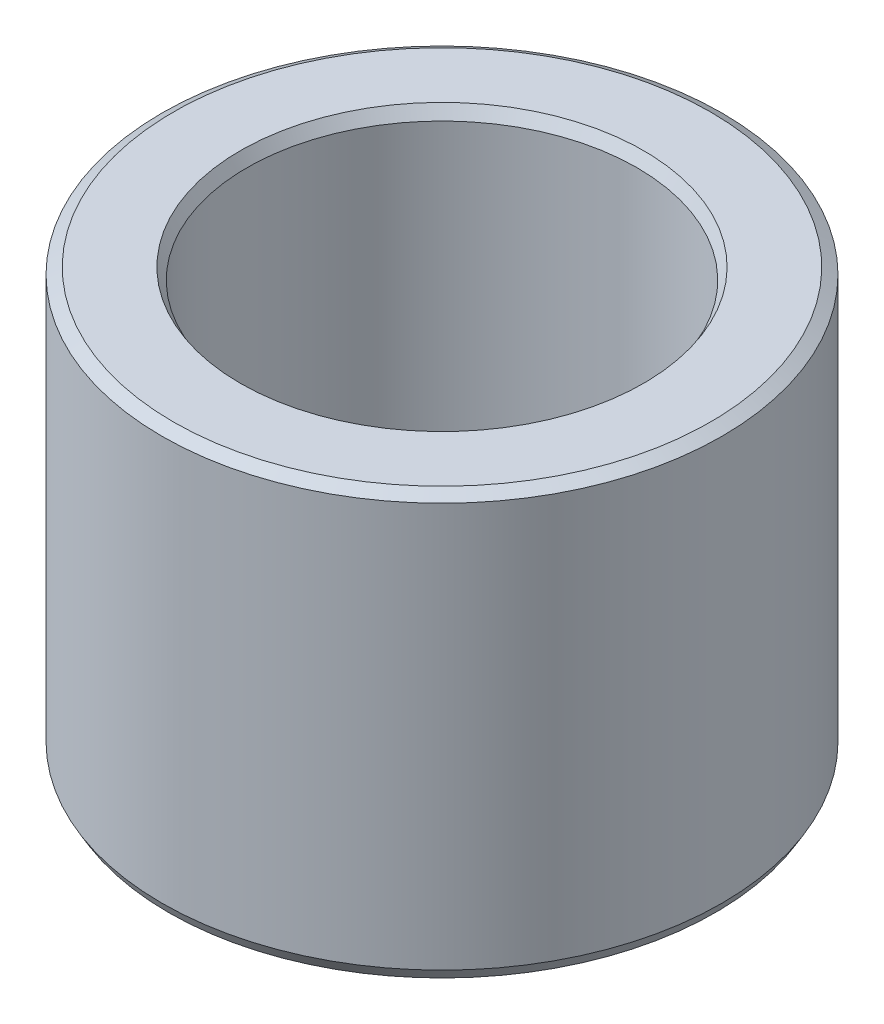
from build123d import *
from OCP.BRepFilletAPI import BRepFilletAPI_MakeChamfer

# Parameters (mm, degrees)
SKETCH1_R           = 57.5
BOSS_EXTRUDE1_DEPTH = 86.751483869
SKETCH2_R           = 40.041894968
CUT_EXTRUDE1_DEPTH  = 119.904667501
CHAMFER1_SIZE       = 1.359545545
CHAMFER1_SIZE2      = 2.354801958


with BuildPart() as part:
    # Sketch1 → Boss-Extrude1 (new body)
    with BuildSketch(Plane(origin=(0, 0, 0), x_dir=(1, 0, 0), z_dir=(0, 1, 0))):
        Circle(SKETCH1_R)
    extrude(amount=BOSS_EXTRUDE1_DEPTH)

    # Sketch2 → Cut-Extrude1 (cut, through all)
    with BuildSketch(Plane(origin=(0, 0, 0), x_dir=(1, 0, 0), z_dir=(0, 1, 0))):
        Circle(SKETCH2_R)
    extrude(amount=CUT_EXTRUDE1_DEPTH, mode=Mode.SUBTRACT)

    # Chamfer1: one chamfer whose edges measure the first distance from different faces: ONE call of the kernel's chamfer builder (chamfer() names one face for all edges)
    chamfer1_edges_1 = [part.edges().sort_by_distance(p)[0] for p in [
        (-40.041894968, 86.751483869, 0),
    ]]
    chamfer1_side_1 = [part.faces().sort_by_distance(p)[0] for p in [
        (-55.873654403, 86.751483869, 0),
    ]]
    chamfer1_edges_2 = [part.edges().sort_by_distance(p)[0] for p in [
        (-40.041894968, 0, 0),
    ]]
    chamfer1_side_2 = [part.faces().sort_by_distance(p)[0] for p in [
        (-40.041894968, 43.375741935, 0),
    ]]
    chamfer1_edges_3 = [part.edges().sort_by_distance(p)[0] for p in [
        (-57.5, 0, 0),
    ]]
    chamfer1_side_3 = [part.faces().sort_by_distance(p)[0] for p in [
        (-55.873654403, 0, 0),
    ]]
    chamfer1_edges_4 = [part.edges().sort_by_distance(p)[0] for p in [
        (-57.5, 86.751483869, 0),
    ]]
    chamfer1_side_4 = [part.faces().sort_by_distance(p)[0] for p in [
        (-57.5, 43.375741935, 0),
    ]]
    chamfer1 = BRepFilletAPI_MakeChamfer(part.part.solid().wrapped)
    for e in chamfer1_edges_1:
        chamfer1.Add(CHAMFER1_SIZE, CHAMFER1_SIZE2, e.wrapped, chamfer1_side_1[0].wrapped)  # the first distance lies on this face
    for e in chamfer1_edges_2:
        chamfer1.Add(CHAMFER1_SIZE, CHAMFER1_SIZE2, e.wrapped, chamfer1_side_2[0].wrapped)  # the first distance lies on this face
    for e in chamfer1_edges_3:
        chamfer1.Add(CHAMFER1_SIZE, CHAMFER1_SIZE2, e.wrapped, chamfer1_side_3[0].wrapped)  # the first distance lies on this face
    for e in chamfer1_edges_4:
        chamfer1.Add(CHAMFER1_SIZE, CHAMFER1_SIZE2, e.wrapped, chamfer1_side_4[0].wrapped)  # the first distance lies on this face
    add(Compound.cast(chamfer1.Shape()), mode=Mode.REPLACE)


solid = part.part
